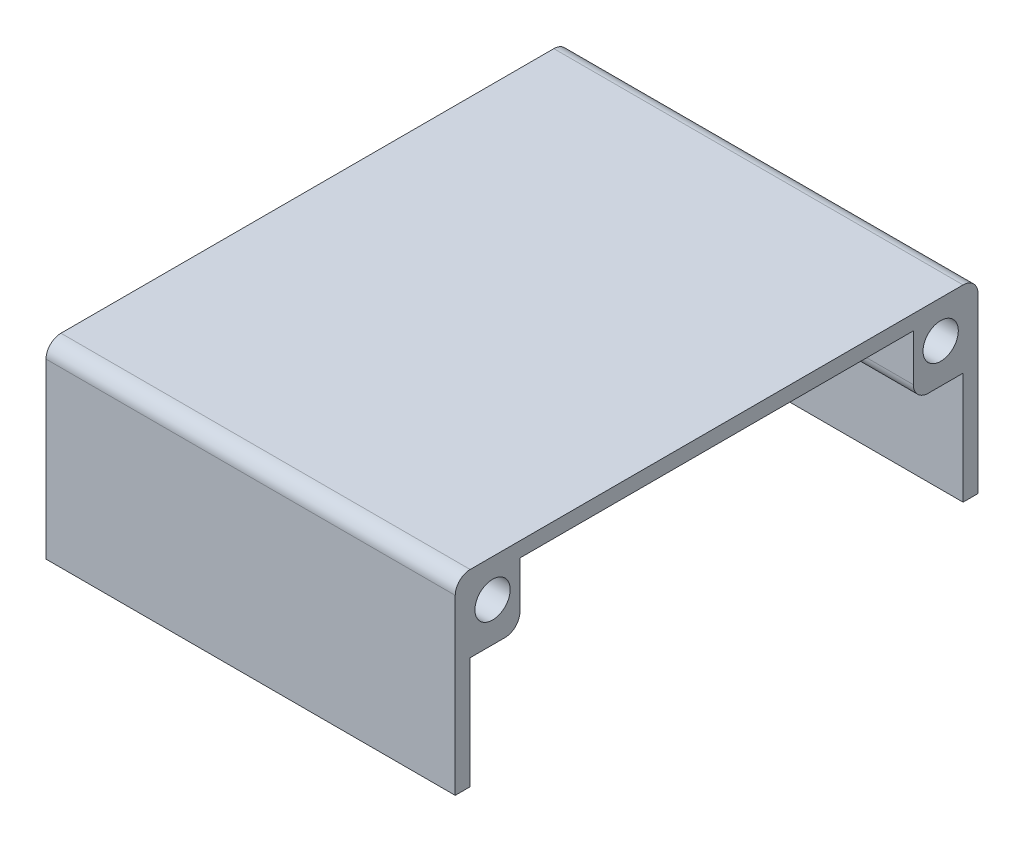
from build123d import *

# Parameters (mm, degrees)
SKETCH1_W           = 88.905
SKETCH1_H           = 32.004
BOSS_EXTRUDE1_DEPTH = 69.596
FILLET1_R           = 2.54
FILLET2_R           = 2.54
SKETCH13_W          = 83.825
SKETCH13_H          = 29.464
CUT_EXTRUDE1_DEPTH  = 90
SKETCH15_W          = 8.46
SKETCH15_H          = 10.46
SKETCH15_R          = 3
BOSS_EXTRUDE8_DEPTH = 69.596
SKETCH19_W          = 8.46
SKETCH19_H          = 10.46
SKETCH19_R          = 3
BOSS_EXTRUDE9_DEPTH = 69.596
FILLET3_R           = 2.54


with BuildPart() as part:
    # Sketch1 → Boss-Extrude1 (new body)
    with BuildSketch(Plane(origin=(0, 0, 0), x_dir=(0, 0, -1), z_dir=(1, 0, 0))):
        Rectangle(SKETCH1_W, SKETCH1_H)
    extrude(amount=BOSS_EXTRUDE1_DEPTH)

    # Fillet1
    fillet1_edges = [part.edges().sort_by_distance(p)[0] for p in [
        (34.798, 16.002, -44.4525),
    ]]
    fillet(fillet1_edges, radius=FILLET1_R)

    # Fillet2
    fillet2_edges = [part.edges().sort_by_distance(p)[0] for p in [
        (34.798, 16.002, 44.4525),
    ]]
    fillet(fillet2_edges, radius=FILLET2_R)

    # Sketch13 → Cut-Extrude1 (cut)
    with BuildSketch(Plane.ZY):
        with Locations((0, -1.27)):
            Rectangle(SKETCH13_W, SKETCH13_H)
    extrude(amount=-CUT_EXTRUDE1_DEPTH, mode=Mode.SUBTRACT)

    # Sketch15 → Boss-Extrude8 (add)
    with BuildSketch(Plane.ZY):
        with Locations((37.6825, 8.232)):
            Rectangle(SKETCH15_W, SKETCH15_H)
        with Locations((38.1025, 9.652)):
            Circle(SKETCH15_R, mode=Mode.SUBTRACT)
    extrude(amount=-BOSS_EXTRUDE8_DEPTH)

    # Sketch19 → Boss-Extrude9 (add)
    with BuildSketch(Plane.ZY):
        with Locations((-37.6825, 8.232)):
            Rectangle(SKETCH19_W, SKETCH19_H)
        with Locations((-38.1025, 9.652)):
            Circle(SKETCH19_R, mode=Mode.SUBTRACT)
    extrude(amount=-BOSS_EXTRUDE9_DEPTH)

    # Fillet3
    fillet3_edges = [part.edges().sort_by_distance(p)[0] for p in [
        (34.798, 3.002, 33.4525),
        (34.798, 3.002, -33.4525),
    ]]
    fillet(fillet3_edges, radius=FILLET3_R)


solid = part.part
